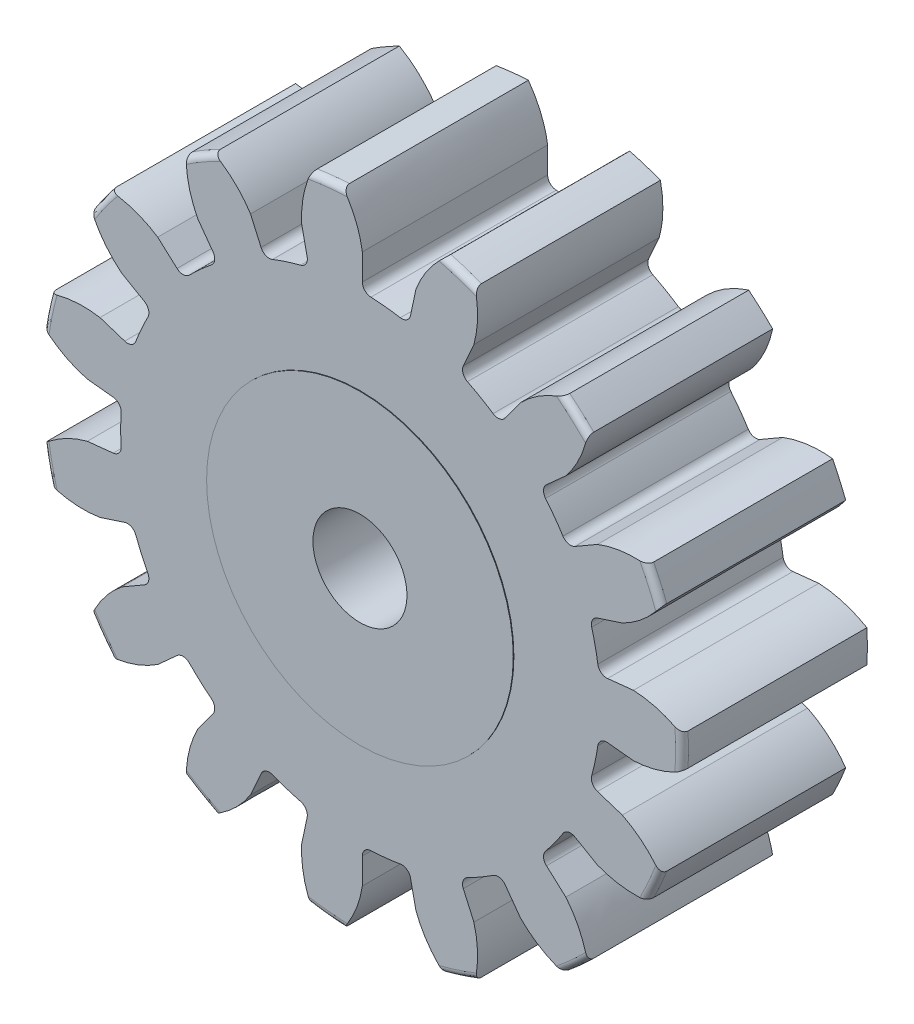
from build123d import *

# Parameters (mm, degrees)
SKETCH1_R                = 10.795
BOSS_EXTRUDE1_DEPTH      = 9.525
SKETCH2_W                = 9.525
SKETCH2_H                = 7.7390625
FILLET2_R                = 0.2159
CUT_EXTRUDE1_DEPTH       = 25.412426183
FILLET1_R                = 0.2992374
CIRPATTERN1_COUNT        = 15
FILLET1_OF_CIRPATTERN1_R = 0.2992374
SKETCH5_R                = 4.7625
CUT_EXTRUDE2_DEPTH       = 25.40533045
CHAMFER1_SIZE            = 0.386953125
SKETCH6_R                = 12.7
CUT_EXTRUDE3_DEPTH       = 12.827
BOSS_EXTRUDE2_START      = -6.24435
SKETCH7_R                = 5.149453125
SKETCH7_R_2              = 1.57861
BOSS_EXTRUDE2_DEPTH      = 6.24435


with BuildPart() as part:
    # Sketch1 → Boss-Extrude1 (new body)
    with BuildSketch(Plane.XY):
        Circle(SKETCH1_R)
    extrude(amount=-BOSS_EXTRUDE1_DEPTH)

    # Sketch2 → Revolve1 (revolve)
    with BuildSketch(Plane(origin=(0, 0, 0), x_dir=(0, 0, -1), z_dir=(1, 0, 0)), mode=Mode.PRIVATE) as revolve1_sk:
        with Locations((14.2875, 3.86953125)):
            Rectangle(SKETCH2_W, SKETCH2_H)
    revolve(revolve1_sk.sketch.rotate(Axis((0, 0, -9.525), (0, 0, -1)), 90), axis=Axis((0, 0, -9.525), (0, 0, -1)))

    # Fillet2
    fillet2_edges = [part.edges().sort_by_distance(p)[0] for p in [
        (-10.795, 0, 0),
        (-10.795, 0, -9.525),
        (-7.7390625, 0, -9.525),
    ]]
    fillet(fillet2_edges, radius=FILLET2_R)

    # Sketch4 → Cut-Extrude1 (cut, through all)
    with BuildSketch(Plane.XY):
        with BuildLine():
            Line((0.059931511, 9.221411524), (0.059931511, 8.05538706))
            ThreePointArc((0.059931511, 8.05538706), (0.842042496, 8.011480319), (1.616191145, 7.891817196))
            Line((1.616191145, 7.891817196), (1.858621822, 9.032361109))
            add(Edge.make_bspline(
                [(3.117257994, 10.666251415), (2.224797274, 10.003468981), (1.858621822, 9.032361109)],
                knots=[0, 0, 0, 1, 1, 1], degree=2))
            ThreePointArc((3.117257994, 10.666251415), (1.161568484, 11.051559858), (-0.831494634, 11.081283018))
            add(Edge.make_bspline(
                [(-0.831494634, 11.081283018), (-0.096336947, 10.247430593), (0.059931511, 9.221411524)],
                knots=[0, 0, 0, 1, 1, 1], degree=2))
        make_face()
    cut_extrude1 = extrude(amount=-CUT_EXTRUDE1_DEPTH, mode=Mode.SUBTRACT)

    # Fillet1
    fillet1_edges = [part.edges().sort_by_distance(p)[0] for p in [
        (1.616191145, 7.891817196, -4.7625),
        (0.059931511, 8.05538706, -4.7625),
    ]]
    fillet(fillet1_edges, radius=FILLET1_R)

    # CirPattern1: Cut-Extrude1 ×15 about axis
    cirpattern1_axis = Axis((0, 0, -9.525), (0, 0, 1))
    for i in range(1, CIRPATTERN1_COUNT):
        add(cut_extrude1.rotate(cirpattern1_axis, i * 360 / CIRPATTERN1_COUNT), mode=Mode.SUBTRACT)

    # Fillet1 of CirPattern1
    fillet1_of_cirpattern1_edges = [part.edges().sort_by_distance(p)[0] for p in [
        (-1.733427155, 7.866897913, -4.7625),
        (-3.221670932, 7.3833386, -4.7625),
        (-4.783320152, 6.481720512, -4.7625),
        (-5.946217202, 5.43464382, -4.7625),
        (-7.00613364, 3.97579475, -4.7625),
        (-7.642608499, 2.546249752, -4.7625),
        (-8.017522972, 0.782417957, -4.7625),
        (-8.017523356, -0.78241403, -4.7625),
        (-7.642609746, -2.546246009, -4.7625),
        (-7.006135587, -3.975791319, -4.7625),
        (-5.946219864, -5.434640908, -4.7625),
        (-4.783323326, -6.481718169, -4.7625),
        (-3.221674548, -7.383337022, -4.7625),
        (-1.733431008, -7.866897064, -4.7625),
        (0.059927566, -8.055387089, -4.7625),
        (1.61618728, -7.891817988, -4.7625),
        (3.331167659, -7.334587548, -4.7625),
        (4.686352104, -6.552171886, -4.7625),
        (6.026418601, -5.345571187, -4.7625),
        (6.946204076, -4.079595741, -4.7625),
        (7.679647019, -2.432257005, -4.7625),
        (8.004994258, -0.901620431, -4.7625),
        (8.0049947, 0.90161651, -4.7625),
        (7.67964821, 2.432253244, -4.7625),
        (6.946206074, 4.079592339, -4.7625),
        (6.026421219, 5.345568235, -4.7625),
        (4.686355313, 6.552169591, -4.7625),
        (3.331171251, 7.334585917, -4.7625),
    ]]
    fillet(fillet1_of_cirpattern1_edges, radius=FILLET1_OF_CIRPATTERN1_R)

    # Sketch5 → Cut-Extrude2 (cut, through all)
    with BuildSketch(Plane.XY):
        Circle(SKETCH5_R)
    extrude(amount=-CUT_EXTRUDE2_DEPTH, mode=Mode.SUBTRACT)

    # Chamfer1
    chamfer1_edges = [part.edges().sort_by_distance(p)[0] for p in [
        (-7.7390625, 0, -19.05),
        (-4.7625, 0, -19.05),
        (-4.7625, 0, 0),
    ]]
    chamfer(chamfer1_edges, length=CHAMFER1_SIZE)

    # Sketch6 → Cut-Extrude3 (cut)
    with BuildSketch(Plane(origin=(0, 0, -19.05), x_dir=(-1, 0, 0), z_dir=(0, 0, -1))):
        Circle(SKETCH6_R)
    extrude(amount=-CUT_EXTRUDE3_DEPTH, mode=Mode.SUBTRACT)

    # Sketch7 → Boss-Extrude2 (add)
    with BuildSketch(Plane(origin=(0, 0, -6.223), x_dir=(-1, 0, 0), z_dir=(0, 0, -1)).offset(BOSS_EXTRUDE2_START)):
        Circle(SKETCH7_R)
        Circle(SKETCH7_R_2, mode=Mode.SUBTRACT)
    extrude(amount=BOSS_EXTRUDE2_DEPTH)


solid = part.part
